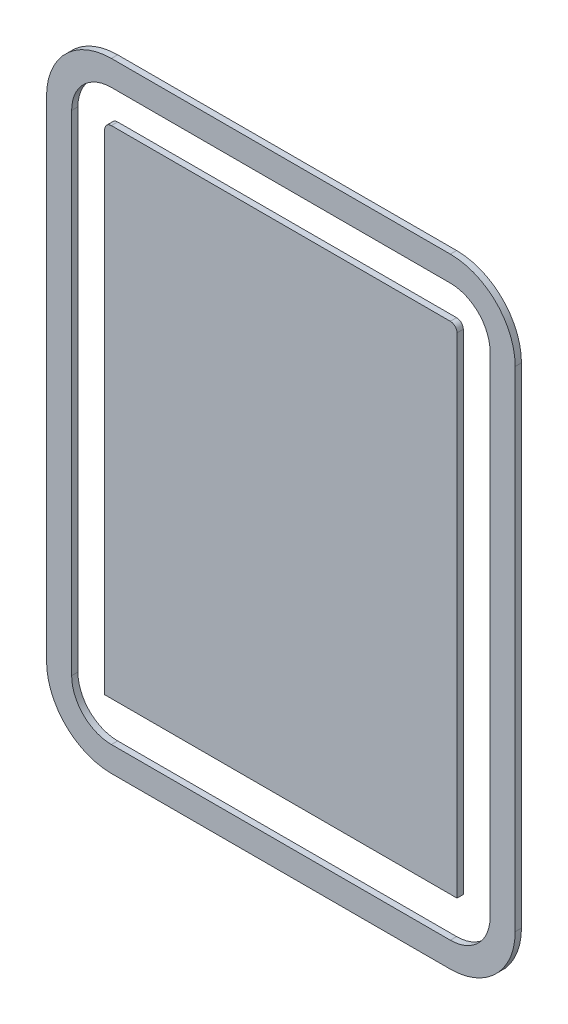
from build123d import *

# Parameters (mm, degrees)
BOSS_EXTRUDE1_DEPTH   = 1.5
BOSS_EXTRUDE1_2_DEPTH = 1.5


with BuildPart() as part:
    # Sketch1 → Boss-Extrude1 (new body)
    with BuildSketch(Plane.XY):
        with BuildLine():
            Line((-61.52326721, 35.470903842), (-61.52326721, -81.529096158))
            Line((-61.52326721, -81.529096158), (22.67673279, -81.529096158))
            Line((22.67673279, -81.529096158), (22.67673279, 35.470903842))
            ThreePointArc((22.67673279, 35.470903842), (22.20810364, 36.602274691), (21.07673279, 37.070903842))
            Line((21.07673279, 37.070903842), (-59.92326721, 37.070903842))
            ThreePointArc((-59.92326721, 37.070903842), (-61.054638059, 36.602274691), (-61.52326721, 35.470903842))
        make_face()
    extrude(amount=BOSS_EXTRUDE1_DEPTH)


with BuildPart() as body_2:
    # Sketch1 → Boss-Extrude1 2 (new body)
    with BuildSketch(Plane.XY):
        with BuildLine():
            ThreePointArc((-75.42326721, -81.529096158), (-70.883422318, -92.489251267), (-59.92326721, -97.029096158))
            Line((-59.92326721, -97.029096158), (21.07673279, -97.029096158))
            ThreePointArc((21.07673279, -97.029096158), (32.036887899, -92.489251267), (36.57673279, -81.529096158))
            Line((36.57673279, -81.529096158), (36.57673279, 35.470903842))
            ThreePointArc((36.57673279, 35.470903842), (32.036887899, 46.43105895), (21.07673279, 50.970903842))
            Line((21.07673279, 50.970903842), (-59.92326721, 50.970903842))
            ThreePointArc((-59.92326721, 50.970903842), (-70.883422318, 46.43105895), (-75.42326721, 35.470903842))
            Line((-75.42326721, 35.470903842), (-75.42326721, -81.529096158))
        make_face()
        with BuildLine():
            Line((30.57673279, 35.470903842), (30.57673279, -81.529096158))
            ThreePointArc((30.57673279, -81.529096158), (27.794247212, -88.24661058), (21.07673279, -91.029096158))
            Line((21.07673279, -91.029096158), (-59.92326721, -91.029096158))
            ThreePointArc((-59.92326721, -91.029096158), (-66.640781631, -88.24661058), (-69.42326721, -81.529096158))
            Line((-69.42326721, -81.529096158), (-69.42326721, 35.470903842))
            ThreePointArc((-69.42326721, 35.470903842), (-66.640781631, 42.188418263), (-59.92326721, 44.970903842))
            Line((-59.92326721, 44.970903842), (21.07673279, 44.970903842))
            ThreePointArc((21.07673279, 44.970903842), (27.794247212, 42.188418263), (30.57673279, 35.470903842))
        make_face(mode=Mode.SUBTRACT)
    extrude(amount=BOSS_EXTRUDE1_2_DEPTH)


solid = Compound([part.part, body_2.part])
